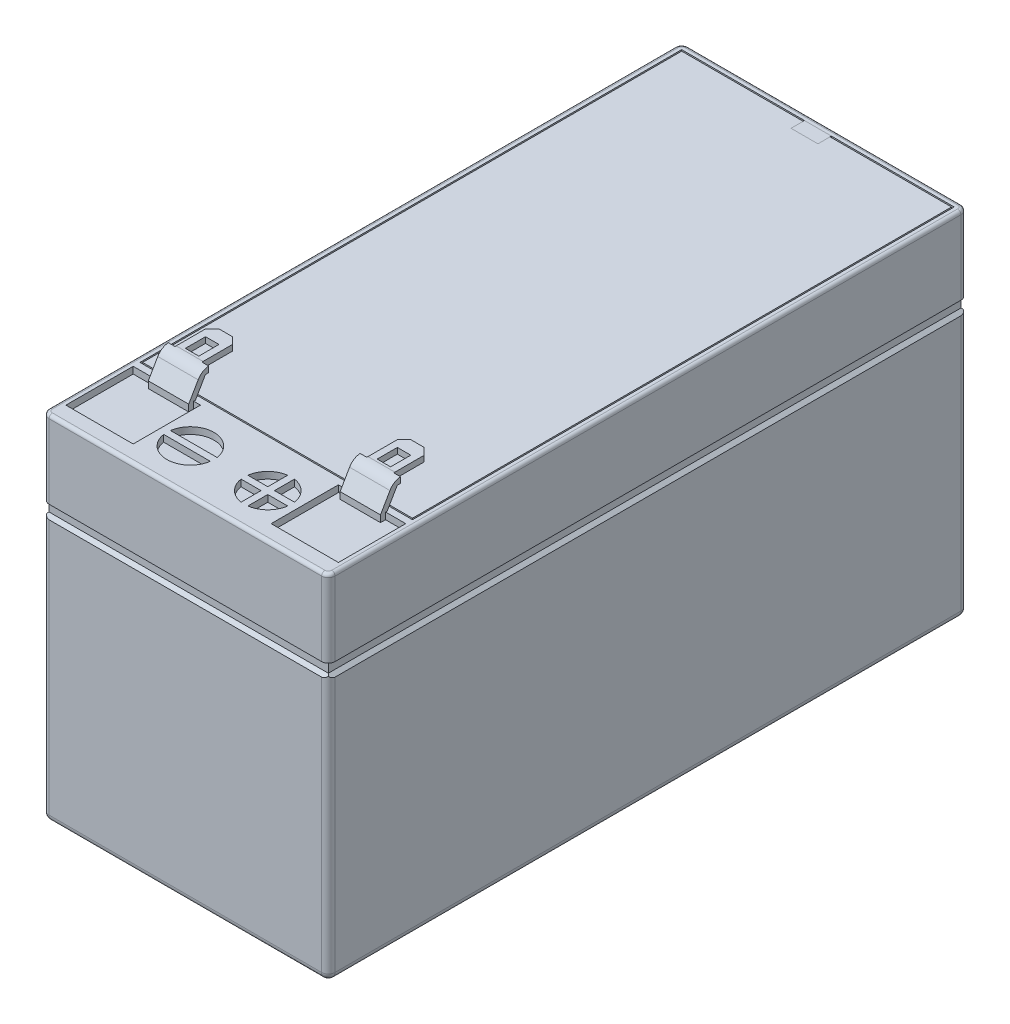
from build123d import *

# Parameters (mm, degrees)
SKETCH_1_W           = 42.5
SKETCH_1_H           = 95
EXTRUDE_1_DEPTH      = 52.5
SKETCH_2_W           = 40.5
SKETCH_2_H           = 80.5
CUT_EXTRUDE_1_DEPTH  = 1
SKETCH_3_W           = 4
SKETCH_3_H           = 1.8
SKETCH_3_H_2         = 0.2
EXTRUDE_2_DEPTH      = 1
FILLET_1_R           = 1
FILLET_2_R           = 1
FILLET_3_R           = 0.5
FILLET_5_R           = 1
CUT_EXTRUDE_2_DEPTH  = 1
SWEEP_START          = 4
SWEEP_1_DEPTH        = 6
SWEEP_START_2        = 32.5
SWEEP_1_2_DEPTH      = 6
SKETCH_8_W           = 1
SKETCH_8_H           = 5.525981616
CUT_EXTRUDE_3_DEPTH  = 1
CHAMFER_2_SIZE       = 1
CHAMFER_3_SIZE       = 1
SKETCH_9_W           = 2
SKETCH_9_H           = 3
CUT_EXTRUDE_5_DEPTH  = 1
FILLET_6_R           = 2
CUT_EXTRUDE_7_DEPTH  = 1
EXTRUDE_3_DEPTH      = 0.5
SKETCH_14_W          = 42.5
SKETCH_14_H          = 1.5
CUT_EXTRUDE_8_DEPTH  = 0.5
SKETCH_15_W          = 95
SKETCH_15_H          = 1.5
CUT_EXTRUDE_9_DEPTH  = 0.5
SKETCH_16_W          = 42.366025404
SKETCH_16_H          = 1.5
CUT_EXTRUDE_10_DEPTH = 0.5
SKETCH_17_W          = 95
SKETCH_17_H          = 1.5
CUT_EXTRUDE_11_DEPTH = 0.5
CHAMFER_4_SIZE       = 0.5


# Read off the part's stored shape, not the designer's step: По траектории1
with BuildPart() as part:
    # Эскиз1 → Бобышка-Вытянуть1 (new body)
    with BuildSketch(Plane(origin=(0, 0, 0), x_dir=(1, 0, 0), z_dir=(0, 1, 0))):
        with Locations((21.25, 47.5)):
            Rectangle(SKETCH_1_W, SKETCH_1_H)
    extrude(amount=EXTRUDE_1_DEPTH)

    # Эскиз2 → Вырез-Вытянуть1 (cut)
    with BuildSketch(Plane(origin=(0, 52.5, 0), x_dir=(1, 0, 0), z_dir=(0, 1, 0))):
        with Locations((21.25, 53.75)):
            Rectangle(SKETCH_2_W, SKETCH_2_H)
        Polygon((23.25, 93.8), (23.25, 92), (19.25, 92), (19.25, 93.8), (1.2, 93.8), (1.2, 13.7), (41.3, 13.7), (41.3, 93.8), align=None, mode=Mode.SUBTRACT)
    extrude(amount=-CUT_EXTRUDE_1_DEPTH, mode=Mode.SUBTRACT)

    # Скругление1
    fillet_1_edges = [part.edges().sort_by_distance(p)[0] for p in [
        (0, 26.25, -95),
        (42.5, 26.25, -95),
    ]]
    fillet(fillet_1_edges, radius=FILLET_1_R)

    # Скругление2
    fillet_2_edges = [part.edges().sort_by_distance(p)[0] for p in [
        (42.5, 26.25, 0),
        (0, 26.25, 0),
    ]]
    fillet(fillet_2_edges, radius=FILLET_2_R)

    # Скругление3
    fillet_3_edges = [part.edges().sort_by_distance(p)[0] for p in [
        (0, 52.5, -47.5),
        (21.25, 52.5, -95),
        (42.207106781, 52.5, -94.707106781),
        (0.292893219, 52.5, -94.707106781),
        (21.25, 52.5, 0),
        (42.5, 52.5, -47.5),
        (42.207106781, 52.5, -0.292893219),
        (0.292893219, 52.5, -0.292893219),
    ]]
    fillet(fillet_3_edges, radius=FILLET_3_R)

    # Скругление5
    fillet_5_edges = [part.edges().sort_by_distance(p)[0] for p in [
        (0, 0, -47.5),
        (21.25, 0, -95),
        (42.207106781, 0, -94.707106781),
        (0.292893219, 0, -94.707106781),
        (21.25, 0, 0),
        (42.5, 0, -47.5),
        (42.207106781, 0, -0.292893219),
        (0.292893219, 0, -0.292893219),
    ]]
    fillet(fillet_5_edges, radius=FILLET_5_R)

    # Эскиз4 → Вырез-Вытянуть2 (cut)
    with BuildSketch(Plane(origin=(0, 52.5, 0), x_dir=(1, 0, 0), z_dir=(0, 1, 0))):
        with BuildLine():
            ThreePointArc((18.964101615, 7), (15.5, 10), (12.035898385, 7))
            Line((12.035898385, 7), (18.964101615, 7))
        make_face()
        with BuildLine():
            Line((18.964101615, 6), (12.035898385, 6))
            ThreePointArc((12.035898385, 6), (15.5, 3), (18.964101615, 6))
        make_face()
        with BuildLine():
            Line((26.5, 6), (23.535898385, 6))
            ThreePointArc((23.535898385, 6), (24.525126266, 4.025126266), (26.5, 3.035898385))
            Line((26.5, 3.035898385), (26.5, 6))
        make_face()
        with BuildLine():
            Line((30.464101615, 6), (27.5, 6))
            Line((27.5, 6), (27.5, 3.035898385))
            ThreePointArc((27.5, 3.035898385), (29.474873734, 4.025126266), (30.464101615, 6))
        make_face()
        with BuildLine():
            Line((27.5, 9.964101615), (27.5, 7))
            Line((27.5, 7), (30.464101615, 7))
            ThreePointArc((30.464101615, 7), (29.474873734, 8.974873734), (27.5, 9.964101615))
        make_face()
        with BuildLine():
            ThreePointArc((26.5, 9.964101615), (24.525126266, 8.974873734), (23.535898385, 7))
            Line((23.535898385, 7), (26.5, 7))
            Line((26.5, 7), (26.5, 9.964101615))
        make_face()
    extrude(amount=-CUT_EXTRUDE_2_DEPTH, mode=Mode.SUBTRACT)

    # По траектории1 outline → По траектории1 (add)
    with BuildSketch(Plane.YZ.offset(SWEEP_START)):
        Polygon((52.5, -12.749646193), (55.066987298, -14.231697), (55.066987298, -20.249646193), (55.933012702, -20.249646193), (55.933012702, -13.731697), (52.5, -11.749646193), align=None)
    extrude(amount=SWEEP_1_DEPTH)

    # Sweep 1 2 outline → Sweep 1 2 (add)
    with BuildSketch(Plane.YZ.offset(SWEEP_START_2)):
        Polygon((52.5, -12.749646193), (55.066987298, -14.231697), (55.066987298, -20.249646193), (55.933012702, -20.249646193), (55.933012702, -13.731697), (52.5, -11.749646193), align=None)
    extrude(amount=SWEEP_1_2_DEPTH)

    # Эскиз8 → Вырез-Вытянуть3 (cut)
    with BuildSketch(Plane(origin=(0, 55.933012702, 0), x_dir=(1, 0, 0), z_dir=(0, 1, 0))):
        with Locations((4.5, 17.486655385)):
            Rectangle(SKETCH_8_W, SKETCH_8_H)
        with Locations((9.5, 17.486655385)):
            Rectangle(SKETCH_8_W, SKETCH_8_H)
        with Locations((33, 17.486655385)):
            Rectangle(SKETCH_8_W, SKETCH_8_H)
        with Locations((38, 17.486655385)):
            Rectangle(SKETCH_8_W, SKETCH_8_H)
    extrude(amount=-CUT_EXTRUDE_3_DEPTH, mode=Mode.SUBTRACT)

    # Фаска2
    chamfer_2_edges = [part.edges().sort_by_distance(p)[0] for p in [
        (5, 55.5, -20.249646193),
        (9, 55.5, -20.249646193),
    ]]
    chamfer(chamfer_2_edges, length=CHAMFER_2_SIZE)

    # Фаска3
    chamfer_3_edges = [part.edges().sort_by_distance(p)[0] for p in [
        (33.5, 55.5, -20.249646193),
        (37.5, 55.5, -20.249646193),
    ]]
    chamfer(chamfer_3_edges, length=CHAMFER_3_SIZE)

    # Эскиз9 → Вырез-Вытянуть5 (cut)
    with BuildSketch(Plane(origin=(0, 55.933012702, 0), x_dir=(1, 0, 0), z_dir=(0, 1, 0))):
        with Locations((7, 16.749646193)):
            Rectangle(SKETCH_9_W, SKETCH_9_H)
        with Locations((35.5, 16.749646193)):
            Rectangle(SKETCH_9_W, SKETCH_9_H)
    extrude(amount=-CUT_EXTRUDE_5_DEPTH, mode=Mode.SUBTRACT)

    # Скругление6
    fillet_6_edges = [part.edges().sort_by_distance(p)[0] for p in [
        (35.5, 55.933012702, -13.731697),
        (7, 55.933012702, -13.731697),
    ]]
    fillet(fillet_6_edges, radius=FILLET_6_R)

    # Эскиз10 → Вырез-Вытянуть7 (cut)
    with BuildSketch(Plane(origin=(0, 52.5, 0), x_dir=(1, 0, 0), z_dir=(0, 1, 0))):
        Polygon((4, 12.5), (1, 12.5), (1, 2.5), (11, 2.5), (11, 12.5), (10, 12.5), (10, 11.749646193), (4, 11.749646193), align=None)
        Polygon((38.5, 11.749646193), (32.5, 11.749646193), (32.5, 12.5), (31.5, 12.5), (31.5, 2.5), (41.5, 2.5), (41.5, 12.5), (38.5, 12.5), align=None)
    extrude(amount=-CUT_EXTRUDE_7_DEPTH, mode=Mode.SUBTRACT)

    # Эскиз12 → Бобышка-Вытянуть3 (add)
    with BuildSketch(Plane(origin=(0, 0, 0), x_dir=(-1, 0, 0), z_dir=(0, -1, 0))):
        Polygon((-5, 3), (-3, 3), (-3, 5), (-3, 9), (-5, 9), (-5, 5), (-9, 5), (-9, 3), align=None)
        Polygon((-37.5, 3), (-33.5, 3), (-33.5, 5), (-37.5, 5), (-37.5, 9), (-39.5, 9), (-39.5, 5), (-39.5, 3), align=None)
        Polygon((-37.5, 92), (-39.5, 92), (-39.5, 90), (-39.5, 86), (-37.5, 86), (-37.5, 90), (-33.5, 90), (-33.5, 92), align=None)
        Polygon((-5, 92), (-9, 92), (-9, 90), (-5, 90), (-5, 86), (-3, 86), (-3, 90), (-3, 92), align=None)
    extrude(amount=EXTRUDE_3_DEPTH)

    # Эскиз14 → Вырез-Вытянуть8 (cut)
    with BuildSketch(Plane.XY):
        with Locations((21.25, 40.25)):
            Rectangle(SKETCH_14_W, SKETCH_14_H)
    extrude(amount=-CUT_EXTRUDE_8_DEPTH, mode=Mode.SUBTRACT)

    # Эскиз15 → Вырез-Вытянуть9 (cut)
    with BuildSketch(Plane.ZY):
        with Locations((-47.5, 40.25)):
            Rectangle(SKETCH_15_W, SKETCH_15_H)
    extrude(amount=-CUT_EXTRUDE_9_DEPTH, mode=Mode.SUBTRACT)

    # Эскиз16 → Вырез-Вытянуть10 (cut)
    with BuildSketch(Plane(origin=(0, 0, -95), x_dir=(-1, 0, 0), z_dir=(0, 0, -1))):
        with Locations((-21.183012702, 40.25)):
            Rectangle(SKETCH_16_W, SKETCH_16_H)
    extrude(amount=-CUT_EXTRUDE_10_DEPTH, mode=Mode.SUBTRACT)

    # Эскиз17 → Вырез-Вытянуть11 (cut)
    with BuildSketch(Plane(origin=(42.5, 0, 0), x_dir=(0, 0, -1), z_dir=(1, 0, 0))):
        with Locations((47.5, 40.25)):
            Rectangle(SKETCH_17_W, SKETCH_17_H)
    extrude(amount=-CUT_EXTRUDE_11_DEPTH, mode=Mode.SUBTRACT)

    # Фаска4
    # the kernel refuses this chamfer: 0.5 mm, written as the material it takes off along each edge
    with BuildSketch(Plane(origin=(42.785841494, 39.5, -95), x_dir=(0, 0.02749587661058229, 0.9996219169112968), z_dir=(-1, 0, 0))) as chamfer_4_piece_1_section:
        Polygon((CHAMFER_4_SIZE * 0.999621916911, -CHAMFER_4_SIZE * 0.0274958766106), (-CHAMFER_4_SIZE * 0.0274958766106, -CHAMFER_4_SIZE * 0.999621916911), (0, 0), align=None)
    chamfer_4_piece_1 = extrude(amount=43.071682988, mode=Mode.PRIVATE)
    chamfer_4_piece_1 = split(chamfer_4_piece_1, bisect_by=Plane(origin=(42, 39.334797923, -94.835682833), z_dir=(1, 0, 0)), keep=Keep.TOP, mode=Mode.PRIVATE)
    chamfer_4_piece_1 = split(chamfer_4_piece_1, bisect_by=Plane(origin=(42.392920747, 39.334797923, -94.5), z_dir=(0, 0, -1)), keep=Keep.TOP, mode=Mode.PRIVATE)
    add(chamfer_4_piece_1, mode=Mode.SUBTRACT)
    with BuildSketch(Plane(origin=(42.785841494, 39.5, -95), x_dir=(0, 0.02749587661058229, 0.9996219169112968), z_dir=(-1, 0, 0))) as chamfer_4_piece_2_section:
        Polygon((CHAMFER_4_SIZE * 0.999621916911, -CHAMFER_4_SIZE * 0.0274958766106), (-CHAMFER_4_SIZE * 0.0274958766106, -CHAMFER_4_SIZE * 0.999621916911), (0, 0), align=None)
    chamfer_4_piece_2 = extrude(amount=43.071682988, mode=Mode.PRIVATE)
    chamfer_4_piece_2 = split(chamfer_4_piece_2, bisect_by=Plane(origin=(0.5, 39.334797923, -94.835682833), z_dir=(1, 0, 0)), keep=Keep.TOP, mode=Mode.PRIVATE)
    chamfer_4_piece_2 = split(chamfer_4_piece_2, bisect_by=Plane(origin=(42, 39.334797923, -94.835682833), z_dir=(-1, 0, 0)), keep=Keep.TOP, mode=Mode.PRIVATE)
    chamfer_4_piece_2 = split(chamfer_4_piece_2, bisect_by=Plane(origin=(21.25, 39.334797923, -94.5), z_dir=(0, 0, -1)), keep=Keep.TOP, mode=Mode.PRIVATE)
    add(chamfer_4_piece_2, mode=Mode.SUBTRACT)
    with BuildSketch(Plane(origin=(42.785841494, 39.5, -95), x_dir=(0, 0.02749587661058229, 0.9996219169112968), z_dir=(-1, 0, 0))) as chamfer_4_piece_3_section:
        Polygon((CHAMFER_4_SIZE * 0.999621916911, -CHAMFER_4_SIZE * 0.0274958766106), (-CHAMFER_4_SIZE * 0.0274958766106, -CHAMFER_4_SIZE * 0.999621916911), (0, 0), align=None)
    chamfer_4_piece_3 = extrude(amount=43.071682988, mode=Mode.PRIVATE)
    chamfer_4_piece_3 = split(chamfer_4_piece_3, bisect_by=Plane(origin=(0.5, 39.334797923, -94.835682833), z_dir=(-1, 0, 0)), keep=Keep.TOP, mode=Mode.PRIVATE)
    chamfer_4_piece_3 = split(chamfer_4_piece_3, bisect_by=Plane(origin=(0.107079253, 39.334797923, -94.5), z_dir=(0, 0, -1)), keep=Keep.TOP, mode=Mode.PRIVATE)
    add(chamfer_4_piece_3, mode=Mode.SUBTRACT)
    with BuildSketch(Plane(origin=(0, 39.5, 0.285841494), x_dir=(0.999621916911297, 0.02749587661058218, 0), z_dir=(0, 0, -1))) as chamfer_4_piece_4_section:
        Polygon((CHAMFER_4_SIZE * 0.999621916911, CHAMFER_4_SIZE * 0.0274958766106), (-CHAMFER_4_SIZE * 0.0274958766106, CHAMFER_4_SIZE * 0.999621916911), (0, 0), align=None)
    chamfer_4_piece_4 = extrude(amount=95.571682988, mode=Mode.PRIVATE)
    chamfer_4_piece_4 = split(chamfer_4_piece_4, bisect_by=Plane(origin=(0.5, 39.334797923, -0.107079253), z_dir=(-1, 0, 0)), keep=Keep.TOP, mode=Mode.PRIVATE)
    chamfer_4_piece_4 = split(chamfer_4_piece_4, bisect_by=Plane(origin=(0.164317167, 39.334797923, -0.5), z_dir=(0, 0, 1)), keep=Keep.TOP, mode=Mode.PRIVATE)
    add(chamfer_4_piece_4, mode=Mode.SUBTRACT)
    with BuildSketch(Plane(origin=(0, 39.5, 0.285841494), x_dir=(0.999621916911297, 0.02749587661058218, 0), z_dir=(0, 0, -1))) as chamfer_4_piece_5_section:
        Polygon((CHAMFER_4_SIZE * 0.999621916911, CHAMFER_4_SIZE * 0.0274958766106), (-CHAMFER_4_SIZE * 0.0274958766106, CHAMFER_4_SIZE * 0.999621916911), (0, 0), align=None)
    chamfer_4_piece_5 = extrude(amount=95.571682988, mode=Mode.PRIVATE)
    chamfer_4_piece_5 = split(chamfer_4_piece_5, bisect_by=Plane(origin=(0.5, 39.334797923, -47.5), z_dir=(-1, 0, 0)), keep=Keep.TOP, mode=Mode.PRIVATE)
    chamfer_4_piece_5 = split(chamfer_4_piece_5, bisect_by=Plane(origin=(0.164317167, 39.334797923, -0.5), z_dir=(0, 0, -1)), keep=Keep.TOP, mode=Mode.PRIVATE)
    chamfer_4_piece_5 = split(chamfer_4_piece_5, bisect_by=Plane(origin=(0.164317167, 39.334797923, -94.5), z_dir=(0, 0, 1)), keep=Keep.TOP, mode=Mode.PRIVATE)
    add(chamfer_4_piece_5, mode=Mode.SUBTRACT)
    with BuildSketch(Plane(origin=(0, 39.5, 0.285841494), x_dir=(0.999621916911297, 0.02749587661058218, 0), z_dir=(0, 0, -1))) as chamfer_4_piece_6_section:
        Polygon((CHAMFER_4_SIZE * 0.999621916911, CHAMFER_4_SIZE * 0.0274958766106), (-CHAMFER_4_SIZE * 0.0274958766106, CHAMFER_4_SIZE * 0.999621916911), (0, 0), align=None)
    chamfer_4_piece_6 = extrude(amount=95.571682988, mode=Mode.PRIVATE)
    chamfer_4_piece_6 = split(chamfer_4_piece_6, bisect_by=Plane(origin=(0.5, 39.334797923, -94.892920747), z_dir=(-1, 0, 0)), keep=Keep.TOP, mode=Mode.PRIVATE)
    chamfer_4_piece_6 = split(chamfer_4_piece_6, bisect_by=Plane(origin=(0.164317167, 39.334797923, -94.5), z_dir=(0, 0, -1)), keep=Keep.TOP, mode=Mode.PRIVATE)
    add(chamfer_4_piece_6, mode=Mode.SUBTRACT)
    with BuildSketch(Plane(origin=(42.5, 39.5, -95.285841494), x_dir=(-0.999621916911297, 0.027495876610582292, 0), z_dir=(0, 0, 1))) as chamfer_4_piece_7_section:
        Polygon((CHAMFER_4_SIZE * 0.999621916911, CHAMFER_4_SIZE * 0.0274958766106), (-CHAMFER_4_SIZE * 0.0274958766106, CHAMFER_4_SIZE * 0.999621916911), (0, 0), align=None)
    chamfer_4_piece_7 = extrude(amount=95.571682988, mode=Mode.PRIVATE)
    chamfer_4_piece_7 = split(chamfer_4_piece_7, bisect_by=Plane(origin=(42, 39.334797923, -94.892920747), z_dir=(1, 0, 0)), keep=Keep.TOP, mode=Mode.PRIVATE)
    chamfer_4_piece_7 = split(chamfer_4_piece_7, bisect_by=Plane(origin=(42.335682833, 39.334797923, -94.5), z_dir=(0, 0, -1)), keep=Keep.TOP, mode=Mode.PRIVATE)
    add(chamfer_4_piece_7, mode=Mode.SUBTRACT)
    with BuildSketch(Plane(origin=(42.5, 39.5, -95.285841494), x_dir=(-0.999621916911297, 0.027495876610582292, 0), z_dir=(0, 0, 1))) as chamfer_4_piece_8_section:
        Polygon((CHAMFER_4_SIZE * 0.999621916911, CHAMFER_4_SIZE * 0.0274958766106), (-CHAMFER_4_SIZE * 0.0274958766106, CHAMFER_4_SIZE * 0.999621916911), (0, 0), align=None)
    chamfer_4_piece_8 = extrude(amount=95.571682988, mode=Mode.PRIVATE)
    chamfer_4_piece_8 = split(chamfer_4_piece_8, bisect_by=Plane(origin=(42.335682833, 39.334797923, -0.5), z_dir=(0, 0, -1)), keep=Keep.TOP, mode=Mode.PRIVATE)
    chamfer_4_piece_8 = split(chamfer_4_piece_8, bisect_by=Plane(origin=(42, 39.334797923, -47.5), z_dir=(1, 0, 0)), keep=Keep.TOP, mode=Mode.PRIVATE)
    chamfer_4_piece_8 = split(chamfer_4_piece_8, bisect_by=Plane(origin=(42.335682833, 39.334797923, -94.5), z_dir=(0, 0, 1)), keep=Keep.TOP, mode=Mode.PRIVATE)
    add(chamfer_4_piece_8, mode=Mode.SUBTRACT)
    with BuildSketch(Plane(origin=(42.5, 39.5, -95.285841494), x_dir=(-0.999621916911297, 0.027495876610582292, 0), z_dir=(0, 0, 1))) as chamfer_4_piece_9_section:
        Polygon((CHAMFER_4_SIZE * 0.999621916911, CHAMFER_4_SIZE * 0.0274958766106), (-CHAMFER_4_SIZE * 0.0274958766106, CHAMFER_4_SIZE * 0.999621916911), (0, 0), align=None)
    chamfer_4_piece_9 = extrude(amount=95.571682988, mode=Mode.PRIVATE)
    chamfer_4_piece_9 = split(chamfer_4_piece_9, bisect_by=Plane(origin=(42.335682833, 39.334797923, -0.5), z_dir=(0, 0, 1)), keep=Keep.TOP, mode=Mode.PRIVATE)
    chamfer_4_piece_9 = split(chamfer_4_piece_9, bisect_by=Plane(origin=(42, 39.334797923, -0.107079253), z_dir=(1, 0, 0)), keep=Keep.TOP, mode=Mode.PRIVATE)
    add(chamfer_4_piece_9, mode=Mode.SUBTRACT)
    with BuildSketch(Plane(origin=(-0.285841494, 39.5, 0), x_dir=(0, 0.027495876610582174, -0.9996219169112968), z_dir=(1, 0, 0))) as chamfer_4_piece_10_section:
        Polygon((CHAMFER_4_SIZE * 0.999621916911, -CHAMFER_4_SIZE * 0.0274958766106), (-CHAMFER_4_SIZE * 0.0274958766106, -CHAMFER_4_SIZE * 0.999621916911), (0, 0), align=None)
    chamfer_4_piece_10 = extrude(amount=43.071682988, mode=Mode.PRIVATE)
    chamfer_4_piece_10 = split(chamfer_4_piece_10, bisect_by=Plane(origin=(0.5, 39.334797923, -0.164317167), z_dir=(-1, 0, 0)), keep=Keep.TOP, mode=Mode.PRIVATE)
    chamfer_4_piece_10 = split(chamfer_4_piece_10, bisect_by=Plane(origin=(0.107079253, 39.334797923, -0.5), z_dir=(0, 0, 1)), keep=Keep.TOP, mode=Mode.PRIVATE)
    add(chamfer_4_piece_10, mode=Mode.SUBTRACT)
    with BuildSketch(Plane(origin=(-0.285841494, 39.5, 0), x_dir=(0, 0.027495876610582174, -0.9996219169112968), z_dir=(1, 0, 0))) as chamfer_4_piece_11_section:
        Polygon((CHAMFER_4_SIZE * 0.999621916911, -CHAMFER_4_SIZE * 0.0274958766106), (-CHAMFER_4_SIZE * 0.0274958766106, -CHAMFER_4_SIZE * 0.999621916911), (0, 0), align=None)
    chamfer_4_piece_11 = extrude(amount=43.071682988, mode=Mode.PRIVATE)
    chamfer_4_piece_11 = split(chamfer_4_piece_11, bisect_by=Plane(origin=(0.5, 39.334797923, -0.164317167), z_dir=(1, 0, 0)), keep=Keep.TOP, mode=Mode.PRIVATE)
    chamfer_4_piece_11 = split(chamfer_4_piece_11, bisect_by=Plane(origin=(21.25, 39.334797923, -0.5), z_dir=(0, 0, 1)), keep=Keep.TOP, mode=Mode.PRIVATE)
    chamfer_4_piece_11 = split(chamfer_4_piece_11, bisect_by=Plane(origin=(42, 39.334797923, -0.164317167), z_dir=(-1, 0, 0)), keep=Keep.TOP, mode=Mode.PRIVATE)
    add(chamfer_4_piece_11, mode=Mode.SUBTRACT)
    with BuildSketch(Plane(origin=(-0.285841494, 39.5, 0), x_dir=(0, 0.027495876610582174, -0.9996219169112968), z_dir=(1, 0, 0))) as chamfer_4_piece_12_section:
        Polygon((CHAMFER_4_SIZE * 0.999621916911, -CHAMFER_4_SIZE * 0.0274958766106), (-CHAMFER_4_SIZE * 0.0274958766106, -CHAMFER_4_SIZE * 0.999621916911), (0, 0), align=None)
    chamfer_4_piece_12 = extrude(amount=43.071682988, mode=Mode.PRIVATE)
    chamfer_4_piece_12 = split(chamfer_4_piece_12, bisect_by=Plane(origin=(42.392920747, 39.334797923, -0.5), z_dir=(0, 0, 1)), keep=Keep.TOP, mode=Mode.PRIVATE)
    chamfer_4_piece_12 = split(chamfer_4_piece_12, bisect_by=Plane(origin=(42, 39.334797923, -0.164317167), z_dir=(1, 0, 0)), keep=Keep.TOP, mode=Mode.PRIVATE)
    add(chamfer_4_piece_12, mode=Mode.SUBTRACT)


with BuildPart() as body_2:
    # Эскиз3 → Бобышка-Вытянуть2 (new body)
    with BuildSketch(Plane(origin=(0, 51.5, 0), x_dir=(1, 0, 0), z_dir=(0, 1, 0))):
        with Locations((21.25, 92.9)):
            Rectangle(SKETCH_3_W, SKETCH_3_H)
        with Locations((21.25, 93.9)):
            Rectangle(SKETCH_3_W, SKETCH_3_H_2)
    extrude(amount=EXTRUDE_2_DEPTH)


solid = Compound([part.part, body_2.part])
